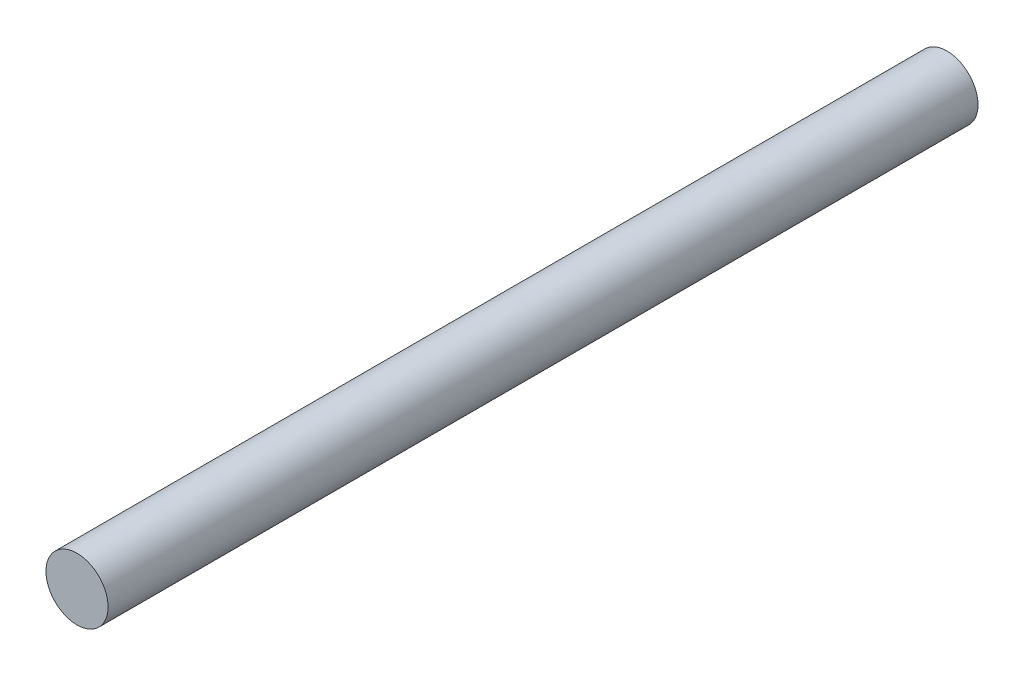
from build123d import *

# Parameters (mm, degrees)
CROQUIS1_R              = 4
SALIENTE_EXTRUIR1_DEPTH = 56


with BuildPart() as part:
    # Croquis1 → Saliente-Extruir1 (new, symmetric)
    with BuildSketch(Plane.XY):
        Circle(CROQUIS1_R)
    extrude(amount=SALIENTE_EXTRUIR1_DEPTH, both=True)


solid = part.part
